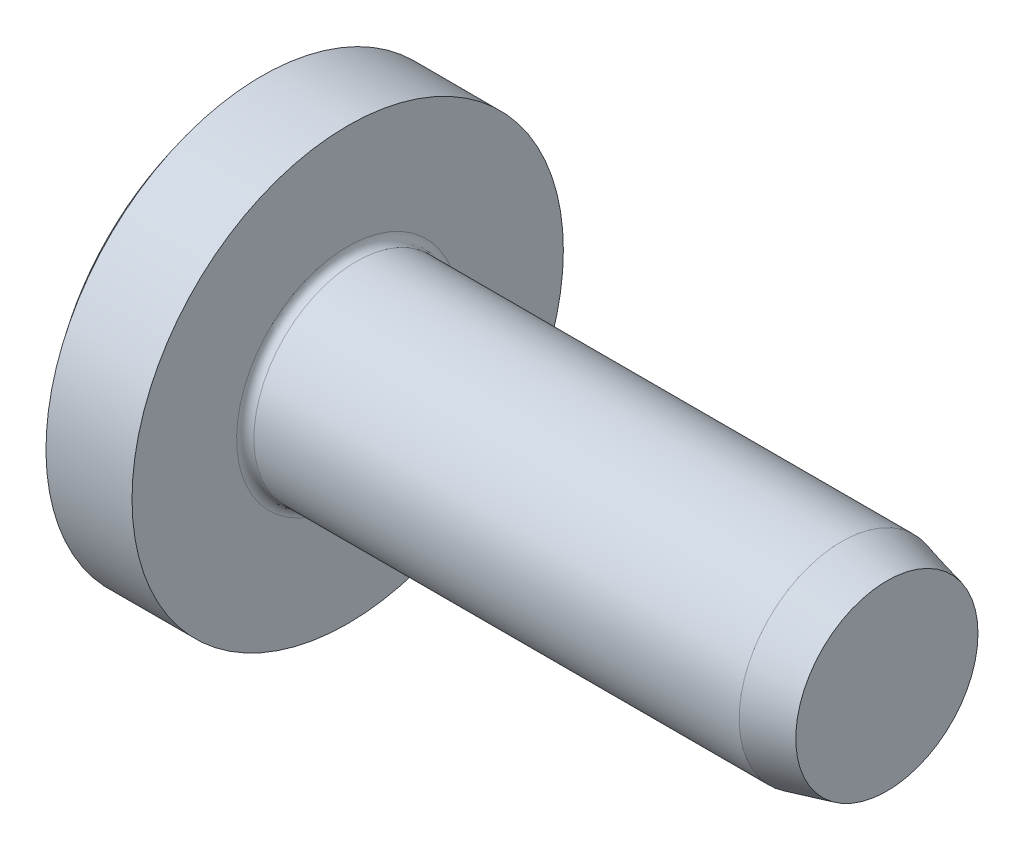
from build123d import *

# Parameters (mm, degrees)
CROSSRECESS_DEPTH = 5.2
FILLET1_R         = 0.4
DRAFT1_ANGLE      = -30


with BuildPart() as part:
    # Sketch1 → Base (revolve)
    with BuildSketch(Plane.XY):
        with BuildLine():
            Line((32.5, 0), (32.5, 4.75))
            Line((32.5, 4.75), (7.5, 4.75))
            Line((7.5, 4.75), (7.5, 10))
            Line((7.5, 10), (3.510004003, 10))
            ThreePointArc((3.510004003, 10), (0.902981487, 5.299059542), (0, 0))
            Line((0, 0), (32.5, 0))
        make_face()
    revolve(axis=Axis((-65.54753617, 0, 0), (1, 0, 0)))

    # Sketch2 → CrossRecess (cut)
    with BuildSketch(Plane(origin=(0, 0, 0), x_dir=(0, 0, -1), z_dir=(1, 0, 0))):
        Polygon((-1.01, 5.05), (1.01, 5.05), (1.01, 1.01), (5.05, 1.01), (5.05, -1.01), (1.01, -1.01), (1.01, -5.05), (-1.01, -5.05), (-1.01, -1.01), (-5.05, -1.01), (-5.05, 1.01), (-1.01, 1.01), align=None)
    extrude(amount=CROSSRECESS_DEPTH, mode=Mode.SUBTRACT)

    # Fillet1
    fillet1_edges = [part.edges().sort_by_distance(p)[0] for p in [
        (7.5, -4.75, 0),
    ]]
    fillet(fillet1_edges, radius=FILLET1_R)

    # Sketch4 → Cut-Revolve1 (revolve, cut)
    with BuildSketch(Plane.XY):
        Polygon((28.3, -4.75), (30.4, -4.75), (32.5, -4.225), (32.5, -5.25), (28.3, -5.25), align=None)
    revolve(axis=Axis((1.328193536, 0, 0), (-1, 0, 0)), mode=Mode.SUBTRACT)

    # Draft1
    draft1_faces = [part.faces().sort_by_distance(p)[0] for p in [
        (3.014519397, -5.05, 0),
        (3.014519397, 0, 5.05),
        (3.014519397, 5.05, 0),
        (3.014519397, 0, -5.05),
    ]]
    draft(draft1_faces, Plane(origin=(0, 0, 0), x_dir=(0, 0, 1), z_dir=(1, 0, 0)), DRAFT1_ANGLE)


solid = part.part
